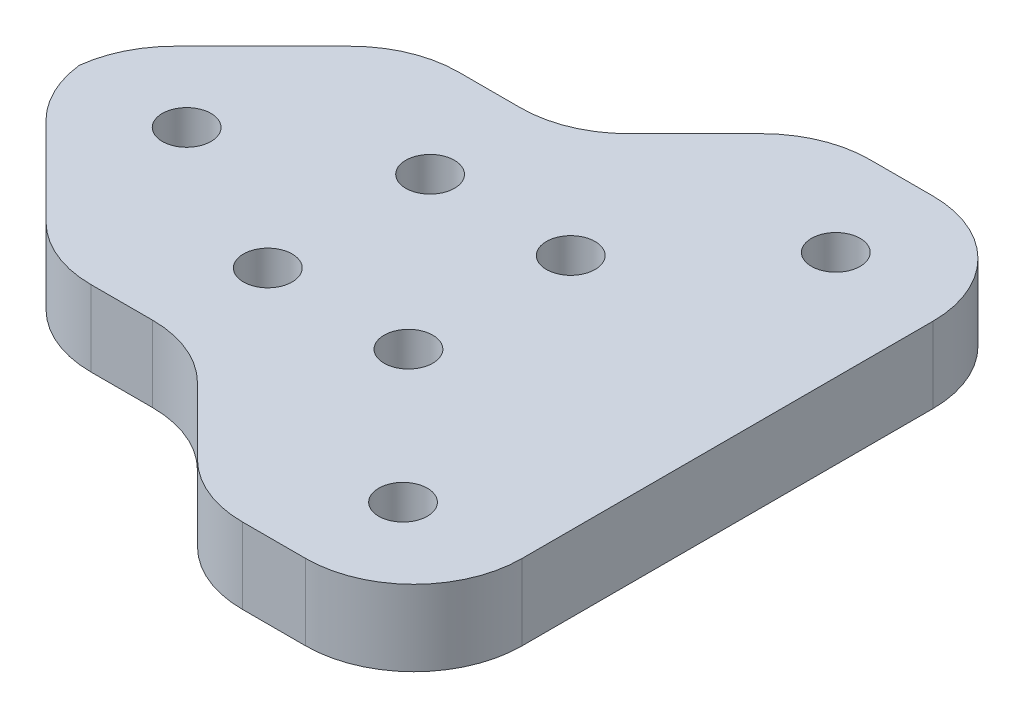
from build123d import *

# Parameters (mm, degrees)
SKETCH1_W            = 60
SKETCH1_H            = 58
BOSS_EXTRUDE1_DEPTH  = 7
M4_CLEARANCE_HOLE2_D = 4.5
LPATTERN1_COUNT      = 2
LPATTERN1_PITCH      = 13
M4_CLEARANCE_HOLE4_D = 4.5
CUT_EXTRUDE5_DEPTH   = 84.743656476
FILLET3_R            = 10


with BuildPart() as part:
    # Sketch1 → Boss-Extrude1 (new body)
    with BuildSketch(Plane(origin=(0, 0, 0), x_dir=(1, 0, 0), z_dir=(0, 1, 0))):
        with Locations((30, 29)):
            Rectangle(SKETCH1_W, SKETCH1_H)
    extrude(amount=BOSS_EXTRUDE1_DEPTH)

    # M4 Clearance Hole2 (through all)
    with Locations(Plane(origin=(0, 0, 0), x_dir=(-1, 0, 0), z_dir=(0, -1, 0))):
        with Locations((-25, 36.5), (-25, 21.5)):
            m4_clearance_hole2 = Hole(M4_CLEARANCE_HOLE2_D / 2)

    # LPattern1: M4 Clearance Hole2 ×2
    with Locations(*[(i * LPATTERN1_PITCH, 0, 0) for i in range(1, LPATTERN1_COUNT)]):
        add(m4_clearance_hole2, mode=Mode.SUBTRACT)

    # M4 Clearance Hole4 (through all)
    with Locations(Plane(origin=(0, 0, 0), x_dir=(-1, 0, 0), z_dir=(0, -1, 0))):
        with Locations((-50, 49), (-50, 9), (-10, 29)):
            Hole(M4_CLEARANCE_HOLE4_D / 2)

    # Sketch29 → Cut-Extrude5 (cut, through all)
    with BuildSketch(Plane.XZ):
        Polygon((40, 0), (28, -12), (14, -12), (0, -26), (0, 0), align=None)
        Polygon((0, -32), (0, -58), (40, -58), (28, -46), (14, -46), align=None)
    extrude(amount=-CUT_EXTRUDE5_DEPTH, mode=Mode.SUBTRACT)

    # Fillet3
    # the kernel refuses this fillet: 10 mm, written as the material it adds along each edge
    with BuildSketch(Plane(origin=(28, 0, -46), x_dir=(-1, 0, 0), z_dir=(0, 1, 0)), Plane(origin=(28, 0, -12), x_dir=(0.7071067811865417, 0, 0.7071067811865532), z_dir=(0, 1, 0))) as fillet3_piece_1:
        with BuildLine():
            CenterArc((FILLET3_R * 0.414213562373, -FILLET3_R), FILLET3_R, 90, 45)
            Line((-FILLET3_R * 0.292893218813, -FILLET3_R * 0.292893218813), (0, 0))
            Line((0, 0), (FILLET3_R * 0.414213562373, 0))
        make_face()
    extrude(amount=7)
    # the kernel refuses this fillet: 10 mm, written as the material it takes off along each edge
    with BuildSketch(Plane(origin=(60, -25, 0), x_dir=(-1, 0, 0), z_dir=(0, 1, 0)), Plane(origin=(60, -25, -58), x_dir=(0, 0, 1), z_dir=(0, 1, 0))) as fillet3_2_piece_1:
        with BuildLine():
            CenterArc((FILLET3_R, -FILLET3_R), FILLET3_R, 90, 90)
            Line((0, -FILLET3_R), (0, 0))
            Line((0, 0), (FILLET3_R, 0))
        make_face()
    extrude(amount=57, mode=Mode.SUBTRACT)
    with BuildSketch(Plane(origin=(40, -10.355339059, -58), x_dir=(-0.7071067811865415, 0, 0.7071067811865536), z_dir=(0, 1, 0)), Plane(origin=(14, -10.355339059, -46), x_dir=(-0.7071067811865411, 0, 0.707106781186554), z_dir=(0, 1, 0)), Plane(origin=(0, -10.355339059, -32), x_dir=(0, 0, 1), z_dir=(0, 1, 0)), Plane(origin=(0, -10.355339059, -26), x_dir=(0.7071067811865417, 0, 0.7071067811865532), z_dir=(0, 1, 0)), Plane(origin=(14, -10.355339059, -12), x_dir=(1, 0, 0), z_dir=(0, 1, 0)), Plane(origin=(40, -10.355339059, 0), x_dir=(1, 0, 0), z_dir=(0, 1, 0))) as fillet3_2_piece_2:
        with BuildLine():
            CenterArc((FILLET3_R * 0.414213562373, FILLET3_R), FILLET3_R, 225, 45)
            Line((-FILLET3_R * 0.292893218813, FILLET3_R * 0.292893218813), (0, 0))
            Line((0, 0), (FILLET3_R * 0.414213562373, 0))
        make_face()
    extrude(amount=27.710678119, mode=Mode.SUBTRACT)


solid = part.part
